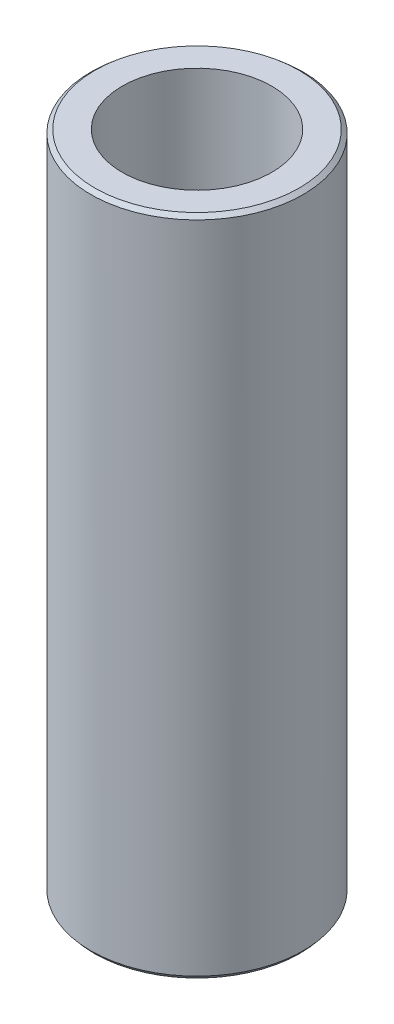
from build123d import *
from OCP.BRepFilletAPI import BRepFilletAPI_MakeChamfer

# Parameters (mm, degrees)
SKETCH1_R           = 40
BOSS_EXTRUDE1_DEPTH = 249.56348913
SKETCH2_R           = 28.165391373
CUT_EXTRUDE1_DEPTH  = 256.894382719
CHAMFER1_SIZE       = 1.31993777
CHAMFER1_SIZE2      = 1.553516649


with BuildPart() as part:
    # Sketch1 → Boss-Extrude1 (new body)
    with BuildSketch(Plane(origin=(0, 0, 0), x_dir=(1, 0, 0), z_dir=(0, 1, 0))):
        Circle(SKETCH1_R)
    extrude(amount=BOSS_EXTRUDE1_DEPTH)

    # Sketch2 → Cut-Extrude1 (cut, through all)
    with BuildSketch(Plane(origin=(0, 0, 0), x_dir=(1, 0, 0), z_dir=(0, 1, 0))):
        Circle(SKETCH2_R)
    extrude(amount=CUT_EXTRUDE1_DEPTH, mode=Mode.SUBTRACT)

    # Chamfer1: one chamfer whose edges measure the first distance from different faces: ONE call of the kernel's chamfer builder (chamfer() names one face for all edges)
    chamfer1_edges_1 = [part.edges().sort_by_distance(p)[0] for p in [
        (-40, 249.56348913, 0),
    ]]
    chamfer1_side_1 = [part.faces().sort_by_distance(p)[0] for p in [
        (-40, 124.781744565, 0),
    ]]
    chamfer1_edges_2 = [part.edges().sort_by_distance(p)[0] for p in [
        (-40, 0, 0),
    ]]
    chamfer1_side_2 = [part.faces().sort_by_distance(p)[0] for p in [
        (-38.86862915, 0, 0),
    ]]
    chamfer1 = BRepFilletAPI_MakeChamfer(part.part.solid().wrapped)
    for e in chamfer1_edges_1:
        chamfer1.Add(CHAMFER1_SIZE, CHAMFER1_SIZE2, e.wrapped, chamfer1_side_1[0].wrapped)  # the first distance lies on this face
    for e in chamfer1_edges_2:
        chamfer1.Add(CHAMFER1_SIZE, CHAMFER1_SIZE2, e.wrapped, chamfer1_side_2[0].wrapped)  # the first distance lies on this face
    add(Compound.cast(chamfer1.Shape()), mode=Mode.REPLACE)


solid = part.part
